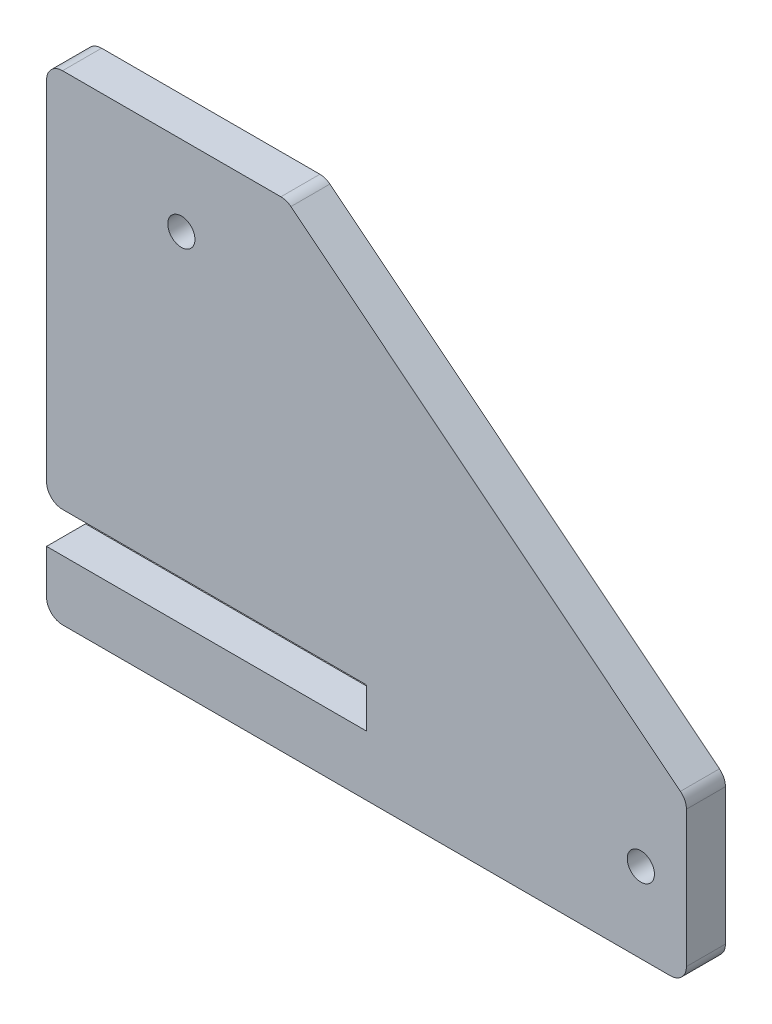
from build123d import *

# Parameters (mm, degrees)
BOSS_EXTRUDE1_DEPTH = 1.5494
SKETCH2_R           = 1.0795
CUT_EXTRUDE1_DEPTH  = 41.77775204
SKETCH3_R           = 1.0795
CUT_EXTRUDE2_DEPTH  = 41.77775204
CUT_EXTRUDE3_DEPTH  = 41.77775204
FILLET1_R           = 1.27


with BuildPart() as part:
    # Sketch1 → Boss-Extrude1 (new, symmetric)
    with BuildSketch(Plane.XY):
        Polygon((-25.4, 1.5875), (0, 1.5875), (0, -1.5875), (-25.4, -1.5875), (-25.4, -6.35), (25.4, -6.35), (25.4, 31.75), (-25.4, 31.75), align=None)
    extrude(amount=BOSS_EXTRUDE1_DEPTH, both=True)

    # Sketch2 → Cut-Extrude1 (cut, through all)
    with BuildSketch(Plane.XY.offset(1.5494)):
        with Locations((21.7805, 0)):
            Circle(SKETCH2_R)
    extrude(amount=-CUT_EXTRUDE1_DEPTH, mode=Mode.SUBTRACT)

    # Sketch3 → Cut-Extrude2 (cut, through all)
    with BuildSketch(Plane.XY.offset(1.5494)):
        with Locations((-14.697472806, 25.4)):
            Circle(SKETCH3_R)
    extrude(amount=-CUT_EXTRUDE2_DEPTH, mode=Mode.SUBTRACT)

    # Sketch4 → Cut-Extrude3 (cut, through all)
    with BuildSketch(Plane.XY.offset(1.5494)):
        Polygon((-6.35, 31.75), (25.4, 6.35), (25.4, 31.75), align=None)
    extrude(amount=-CUT_EXTRUDE3_DEPTH, mode=Mode.SUBTRACT)

    # Fillet1
    fillet1_edges = [part.edges().sort_by_distance(p)[0] for p in [
        (-25.4, -6.35, 0),
        (25.4, -6.35, 0),
        (-25.4, 1.5875, 0),
        (-25.4, 31.75, 0),
        (25.4, 6.35, 0),
        (-6.35, 31.75, 0),
    ]]
    fillet(fillet1_edges, radius=FILLET1_R)


solid = part.part
